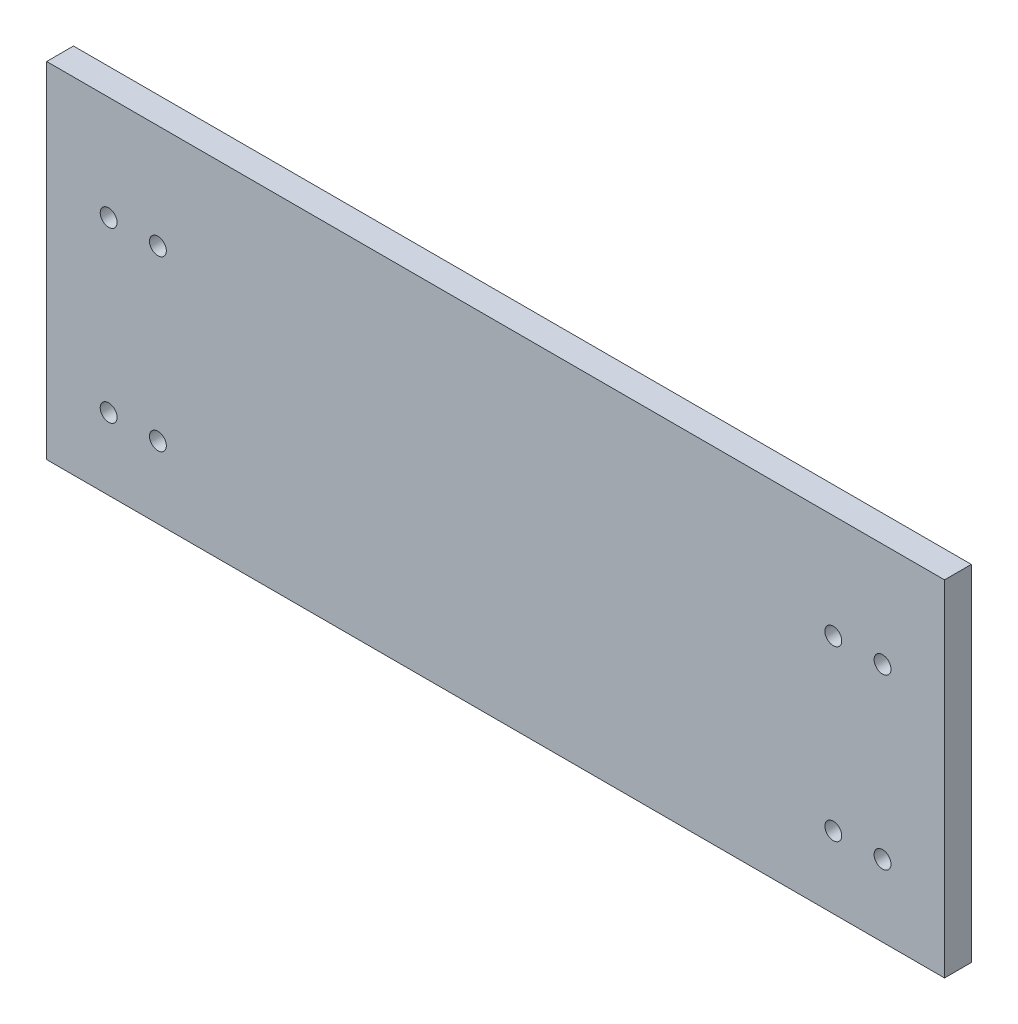
from build123d import *

# Parameters (mm, degrees)
SKETCH1_W                  = 638.1
SKETCH1_H                  = 245.05
BOSS_EXTRUDE1_DEPTH        = 19.05
F_12_0MM_DOWEL_HOLE1_D     = 12
F_12_0MM_DOWEL_HOLE1_DEPTH = 26.394836286
F_12_0MM_DOWEL_HOLE1_TIP   = 3.605163714


with BuildPart() as part:
    # Sketch1 → Boss-Extrude1 (new body)
    with BuildSketch(Plane.XY):
        with Locations((0, -103.475)):
            Rectangle(SKETCH1_W, SKETCH1_H)
    extrude(amount=BOSS_EXTRUDE1_DEPTH)

    # Ø12.0mm Dowel Hole1
    with Locations(Plane.XY.offset(19.05)):
        with Locations((275, -175), (275, -55), (240, -175), (240, -55), (-275, -175), (-240, -175), (-240, -55), (-275, -55)):
            Hole(F_12_0MM_DOWEL_HOLE1_D / 2, depth=F_12_0MM_DOWEL_HOLE1_DEPTH)
            with Locations((0, 0, -(F_12_0MM_DOWEL_HOLE1_DEPTH + F_12_0MM_DOWEL_HOLE1_TIP / 2))):  # 118° drill point
                Cone(0, F_12_0MM_DOWEL_HOLE1_D / 2, F_12_0MM_DOWEL_HOLE1_TIP, mode=Mode.SUBTRACT)


solid = part.part
